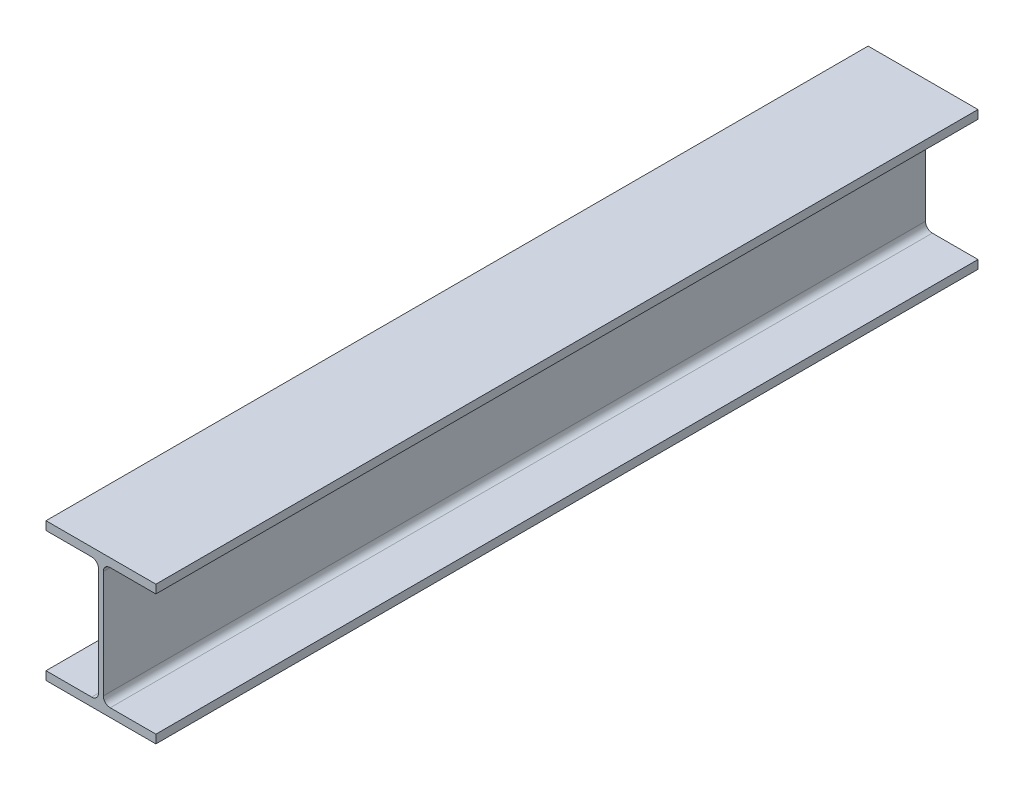
from build123d import *

# Parameters (mm, degrees)
BASESTEELW_DEPTH = 762


with BuildPart() as part:
    # Sketch1 → BaseSteelW (new, symmetric)
    with BuildSketch(Plane.XY):
        with BuildLine():
            Line((0, 0), (0, 15.748))
            Line((0, 15.748), (84.709, 15.748))
            ThreePointArc((84.709, 15.748), (93.689256121, 19.467743879), (97.409, 28.448))
            Line((97.409, 28.448), (97.409, 228.092))
            ThreePointArc((97.409, 228.092), (93.689256121, 237.072256121), (84.709, 240.792))
            Line((84.709, 240.792), (0, 240.792))
            Line((0, 240.792), (0, 256.54))
            Line((0, 256.54), (203.708, 256.54))
            Line((203.708, 256.54), (203.708, 240.792))
            Line((203.708, 240.792), (118.999, 240.792))
            ThreePointArc((118.999, 240.792), (110.018743879, 237.072256121), (106.299, 228.092))
            Line((106.299, 228.092), (106.299, 28.448))
            ThreePointArc((106.299, 28.448), (110.018743879, 19.467743879), (118.999, 15.748))
            Line((118.999, 15.748), (203.708, 15.748))
            Line((203.708, 15.748), (203.708, 0))
            Line((203.708, 0), (0, 0))
        make_face()
    extrude(amount=BASESTEELW_DEPTH, both=True)


solid = part.part
